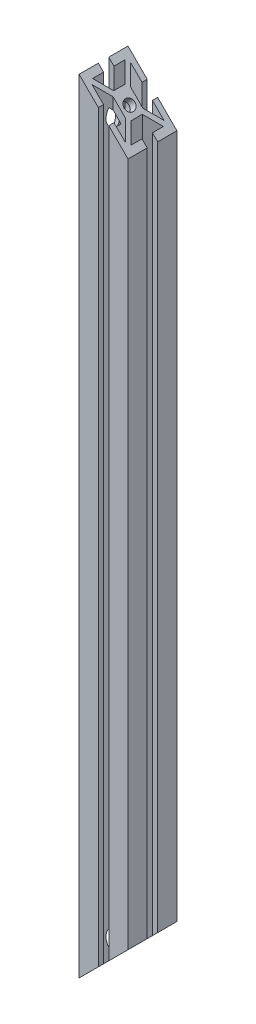
from build123d import *

# Parameters (mm, degrees)
EXTRUDE1_DEPTH = 609.6
EXTRUDE2_DEPTH = 612.086468922
SKETCH5_R      = 4.1656
EXTRUDE3_DEPTH = 445.930684208
SKETCH6_R      = 9.525
EXTRUDE4_DEPTH = 44.45


# Read off the part's stored shape, not the designer's step: 1515<1>
with BuildPart() as part:
    # Sketch1<2> → Extrude1 (new body)
    with BuildSketch(Plane(origin=(0, 0, 0), x_dir=(1, 0, 0), z_dir=(0, 1, 0))):
        Polygon((-6.7564, 4.364749804), (-6.7564, -4.364749804), (-14.986, -12.594349804), (-14.986, -4.064), (-19.05, -4.064), (-19.05, -19.05), (-4.064, -19.05), (-4.064, -14.986), (-13.067127258, -14.986), (-4.837527258, -6.7564), (4.837527258, -6.7564), (13.067127258, -14.986), (4.064, -14.986), (4.064, -19.05), (19.05, -19.05), (19.05, -4.064), (14.986, -4.064), (14.986, -12.594349804), (6.7564, -4.364749804), (6.7564, 4.364749804), (14.986, 12.594349804), (14.986, 4.064), (19.05, 4.064), (19.05, 19.05), (4.064, 19.05), (4.064, 14.986), (13.067127258, 14.986), (4.837527258, 6.7564), (-4.837527258, 6.7564), (-13.067127258, 14.986), (-4.064, 14.986), (-4.064, 19.05), (-19.05, 19.05), (-19.05, 4.064), (-14.986, 4.064), (-14.986, 12.594349804), align=None)
    extrude(amount=EXTRUDE1_DEPTH)

    # Sketch2 → Extrude2 (cut, through all)
    with BuildSketch(Plane.XY.offset(19.05)):
        Polygon((-19.05, 609.6), (19.05, 609.6), (19.05, 571.5), align=None)
        Polygon((19.05, 0), (19.05, 38.1), (-19.05, 0), align=None)
    extrude(amount=-EXTRUDE2_DEPTH, mode=Mode.SUBTRACT)

    # Sketch5 → Extrude3 (cut, through all)
    with BuildSketch(Plane(origin=(295.275, 295.275, 0), x_dir=(-0.7071067811865561, 0.7071067811865389, 5.599314837219468e-15), z_dir=(0.7071067811865389, 0.7071067811865561, 5.599314837219606e-15))):
        with Locations((415.947677993, 0)):
            Circle(SKETCH5_R)
    extrude3 = extrude(amount=-EXTRUDE3_DEPTH, mode=Mode.SUBTRACT)

    # Sketch6 → Extrude4 (cut)
    with BuildSketch(Plane(origin=(259.353975516, 259.353975516, 0), x_dir=(-0.7071067811865515, 0.7071067811865437, 0), z_dir=(0.7071067811865437, 0.7071067811865515, 0))):
        with Locations((415.947677993, 0)):
            Circle(SKETCH6_R)
    extrude4 = extrude(amount=EXTRUDE4_DEPTH, mode=Mode.SUBTRACT)

    # Mirror14: Extrude3, Extrude4 across plane
    add(extrude3.mirror(Plane.ZX.offset(304.8)), mode=Mode.SUBTRACT)
    add(extrude4.mirror(Plane.ZX.offset(304.8)), mode=Mode.SUBTRACT)


solid = part.part
